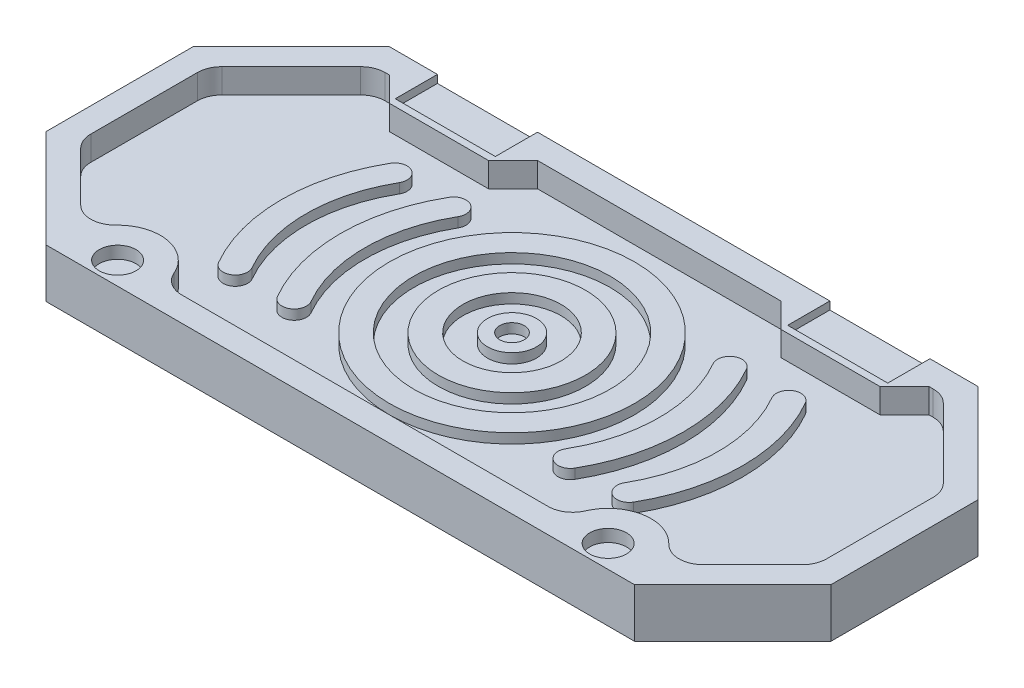
from build123d import *

# Parameters (mm, degrees)
BOSS_EXTRUDE1_DEPTH  = 12.7
SKETCH2_R            = 4.7625
CUT_EXTRUDE1_DEPTH   = 3.175
SHELL2_START         = 6.35
SHELL2_DEPTH         = 6.35
FILLET3_R            = 6.35
BOSS_EXTRUDE2_DEPTH  = 6.35
CUT_EXTRUDE2_START   = 6.35
SKETCH4_W            = 25.908
SKETCH4_H            = 10.922
CUT_EXTRUDE2_DEPTH   = 2.032
CUT_EXTRUDE3_DEPTH   = 6.35
SKETCH6_R            = 31.75
SKETCH6_R_2          = 25.4
BOSS_EXTRUDE3_DEPTH  = 2.54
SKETCH7_R            = 19.05
SKETCH7_R_2          = 12.7
BOSS_EXTRUDE4_DEPTH  = 2.54
SKETCH8_R            = 6.35
SKETCH8_R_2          = 3.175
BOSS_EXTRUDE5_DEPTH  = 2.54
BOSS_EXTRUDE6_DEPTH  = 2.54
LPATTERN1_COUNT      = 2
LPATTERN1_PITCH      = 15.24
MIRROR3_COPY_1_DEPTH = 2.54


# Read off the part's stored shape, not the designer's step: Shell2
with BuildPart() as part:
    # Sketch1 → Boss-Extrude1 (new body)
    with BuildSketch(Plane(origin=(0, 0, 0), x_dir=(1, 0, 0), z_dir=(0, 1, 0))):
        Polygon((-76.2, 44.45), (-101.6, 19.05), (-101.6, -19.05), (-76.2, -44.45), (76.2, -44.45), (101.6, -19.05), (101.6, 19.05), (76.2, 44.45), align=None)
    extrude(amount=BOSS_EXTRUDE1_DEPTH)

    # Sketch2 → Cut-Extrude1 (cut)
    with BuildSketch(Plane(origin=(0, 12.7, 0), x_dir=(1, 0, 0), z_dir=(0, 1, 0))):
        with Locations(Location((-63.5, -38.608, 0), (0, 0, 270))):
            Circle(SKETCH2_R)
    cut_extrude1 = extrude(amount=-CUT_EXTRUDE1_DEPTH, mode=Mode.SUBTRACT)

    # Mirror1: Cut-Extrude1 across plane
    add(cut_extrude1.mirror(Plane(origin=(0, 0, 0), x_dir=(0, 0, 1), z_dir=(1, 0, 0))), mode=Mode.SUBTRACT)

    # Shell2 outline → Shell2 (cut)
    with BuildSketch(Plane(origin=(0, 0, 0), x_dir=(1, 0, 0), z_dir=(0, 1, 0)).offset(SHELL2_START)):
        with BuildLine():
            Line((74.516823481, -37.152920398), (95.25, -16.419743879))
            Line((95.25, -16.419743879), (95.25, 16.419743879))
            Line((95.25, 16.419743879), (73.569743879, 38.1))
            Line((73.569743879, 38.1), (-73.569743879, 38.1))
            Line((-73.569743879, 38.1), (-95.25, 16.419743879))
            Line((-95.25, 16.419743879), (-95.25, -16.419743879))
            Line((-95.25, -16.419743879), (-74.516823481, -37.152920398))
            ThreePointArc((-74.516823481, -37.152920398), (-63.024598672, -27.505673675), (-52.399117501, -38.1))
            Line((-52.399117501, -38.1), (52.399117501, -38.1))
            ThreePointArc((52.399117501, -38.1), (63.024598672, -27.505673675), (74.516823481, -37.152920398))
        make_face()
    extrude(amount=SHELL2_DEPTH, mode=Mode.SUBTRACT)

    # Fillet3
    fillet3_edges = [part.edges().sort_by_distance(p)[0] for p in [
        (95.25, 9.525, 16.419743879),
        (95.25, 9.525, -16.419743879),
        (73.569743879, 9.525, -38.1),
        (-73.569743879, 9.525, -38.1),
        (-95.25, 9.525, -16.419743879),
        (-95.25, 9.525, 16.419743879),
        (52.399117501, 9.525, 38.1),
        (-52.399117501, 9.525, 38.1),
        (-74.516823481, 9.525, 37.152920398),
        (74.516823481, 9.525, 37.152920398),
    ]]
    fillet(fillet3_edges, radius=FILLET3_R)

    # Sketch3 → Boss-Extrude2 (add)
    with BuildSketch(Plane(origin=(0, 6.35, 0), x_dir=(1, 0, 0), z_dir=(0, 1, 0))):
        Polygon((-76.2, 44.45), (-63.5, 31.75), (63.5, 31.75), (76.2, 44.45), align=None)
    extrude(amount=BOSS_EXTRUDE2_DEPTH)

    # Sketch4 → Cut-Extrude2 (cut)
    with BuildSketch(Plane(origin=(0, 6.35, 0), x_dir=(1, 0, 0), z_dir=(0, 1, 0)).offset(CUT_EXTRUDE2_START)):
        with Locations((-50.8, 38.989)):
            Rectangle(SKETCH4_W, SKETCH4_H)
    cut_extrude2 = extrude(amount=-CUT_EXTRUDE2_DEPTH, mode=Mode.SUBTRACT)

    # Mirror2: Cut-Extrude2 across plane
    add(cut_extrude2.mirror(Plane(origin=(0, 0, 0), x_dir=(0, 0, 1), z_dir=(1, 0, 0))), mode=Mode.SUBTRACT)

    # Sketch5 → Cut-Extrude3 (cut)
    with BuildSketch(Plane(origin=(0, 12.7, 0), x_dir=(1, 0, 0), z_dir=(0, 1, 0))):
        Polygon((-37.846, 31.75), (-31.496, 38.1), (31.496, 38.1), (37.846, 31.75), align=None)
    extrude(amount=-CUT_EXTRUDE3_DEPTH, mode=Mode.SUBTRACT)

    # Sketch6 → Boss-Extrude3 (add)
    with BuildSketch(Plane(origin=(0, 6.35, 0), x_dir=(1, 0, 0), z_dir=(0, 1, 0))):
        with Locations(Location((0, 0, 0), (0, 0, 270))):
            Circle(SKETCH6_R)
        with Locations(Location((0, 0, 0), (0, 0, 270))):
            Circle(SKETCH6_R_2, mode=Mode.SUBTRACT)
    extrude(amount=BOSS_EXTRUDE3_DEPTH)

    # Sketch7 → Boss-Extrude4 (add)
    with BuildSketch(Plane(origin=(0, 6.35, 0), x_dir=(1, 0, 0), z_dir=(0, 1, 0))):
        with Locations(Location((0, 0, 0), (0, 0, 270))):
            Circle(SKETCH7_R)
        with Locations(Location((0, 0, 0), (0, 0, 270))):
            Circle(SKETCH7_R_2, mode=Mode.SUBTRACT)
    extrude(amount=BOSS_EXTRUDE4_DEPTH)

    # Sketch8 → Boss-Extrude5 (add)
    with BuildSketch(Plane(origin=(0, 6.35, 0), x_dir=(1, 0, 0), z_dir=(0, 1, 0))):
        with Locations(Location((0, 0, 0), (0, 0, 270))):
            Circle(SKETCH8_R)
        with Locations(Location((0, 0, 0), (0, 0, 270))):
            Circle(SKETCH8_R_2, mode=Mode.SUBTRACT)
    extrude(amount=BOSS_EXTRUDE5_DEPTH)

    # Sketch9 → Boss-Extrude6 (add)
    with BuildSketch(Plane(origin=(0, 6.35, 0), x_dir=(1, 0, 0), z_dir=(0, 1, 0))):
        with BuildLine():
            ThreePointArc((-38.494829198, 22.225), (-44.45, 0), (-38.494829198, -22.225))
            ThreePointArc((-38.494829198, -22.225), (-34.157698541, -23.387130657), (-32.995567884, -19.05))
            ThreePointArc((-32.995567884, -19.05), (-38.1, 0), (-32.995567884, 19.05))
            ThreePointArc((-32.995567884, 19.05), (-34.157698541, 23.387130657), (-38.494829198, 22.225))
        make_face()
    boss_extrude6 = extrude(amount=BOSS_EXTRUDE6_DEPTH)

    # LPattern1: Boss-Extrude6 ×2
    with Locations(*[(-i * LPATTERN1_PITCH, 0, 0) for i in range(1, LPATTERN1_COUNT)]):
        add(boss_extrude6)

    # Mirror3: Boss-Extrude6 across plane
    add(boss_extrude6.mirror(Plane(origin=(0, 0, 0), x_dir=(0, 0, 1), z_dir=(1, 0, 0))))

    # Mirror3 copy 1 sketch → Mirror3 copy 1 (add)
    with BuildSketch(Plane(origin=(15.24, 6.35, 0), x_dir=(-1, 0, 0), z_dir=(0, 1, 0))):
        with BuildLine():
            ThreePointArc((-38.494829198, -22.225), (-44.45, 0), (-38.494829198, 22.225))
            ThreePointArc((-38.494829198, 22.225), (-34.157698541, 23.387130657), (-32.995567884, 19.05))
            ThreePointArc((-32.995567884, 19.05), (-38.1, 0), (-32.995567884, -19.05))
            ThreePointArc((-32.995567884, -19.05), (-34.157698541, -23.387130657), (-38.494829198, -22.225))
        make_face()
    extrude(amount=MIRROR3_COPY_1_DEPTH)


solid = part.part
